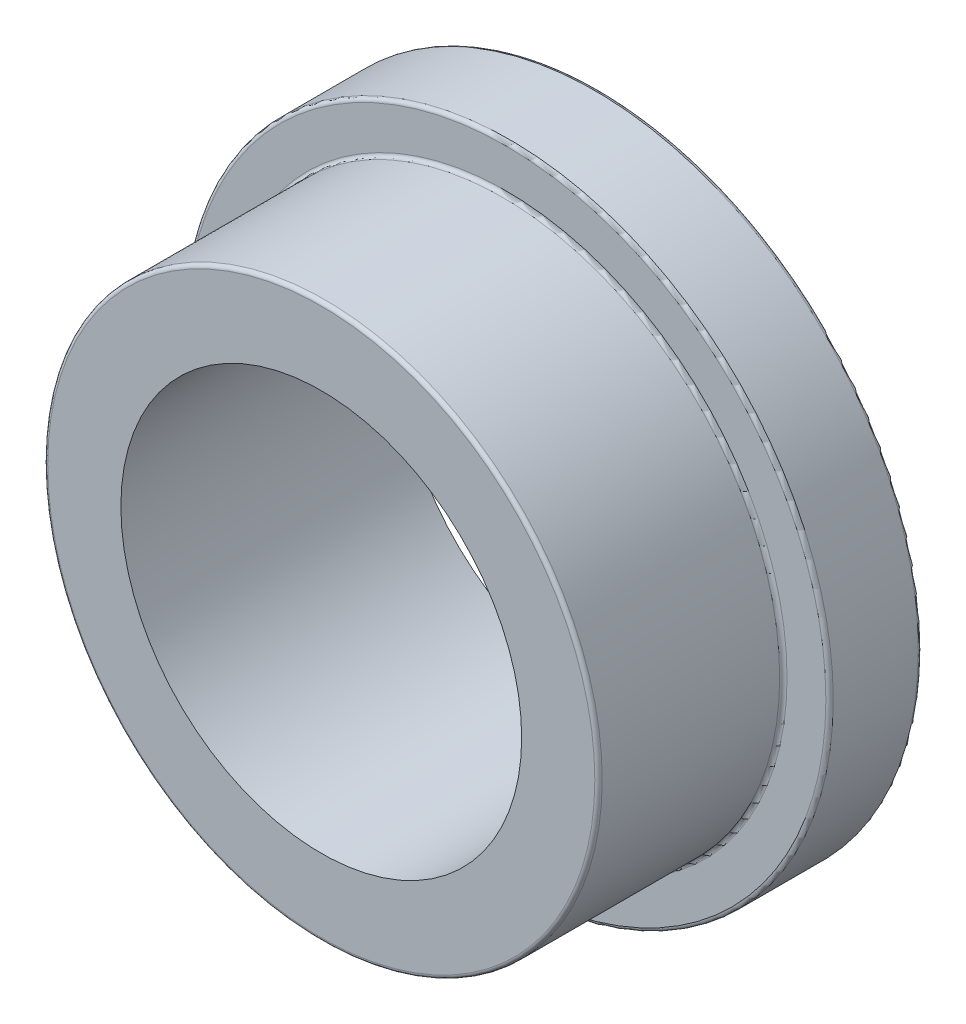
from build123d import *

# Parameters (mm, degrees)
MINOR_FILLET_SMOOTHING_R = 0.127


with BuildPart() as part:
    # Sketch1 → Revolve1 (revolve)
    with BuildSketch(Plane(origin=(0, 0, 0), x_dir=(1, 0, 0), z_dir=(0, 1, 0))):
        Polygon((6.885, -6.35), (9.525, -6.35), (9.525, 0), (11.1125, 0), (11.1125, 3.175), (6.885, 3.175), align=None)
    revolve(axis=Axis((0, 0, -3.175), (0, 0, 1)))

    # Minor Fillet Smoothing
    minor_fillet_smoothing_edges = [part.edges().sort_by_distance(p)[0] for p in [
        (-9.525, 0, 0),
        (-9.525, 0, 6.35),
        (-11.1125, 0, 0),
        (-11.1125, 0, -3.175),
    ]]
    fillet(minor_fillet_smoothing_edges, radius=MINOR_FILLET_SMOOTHING_R)


solid = part.part
